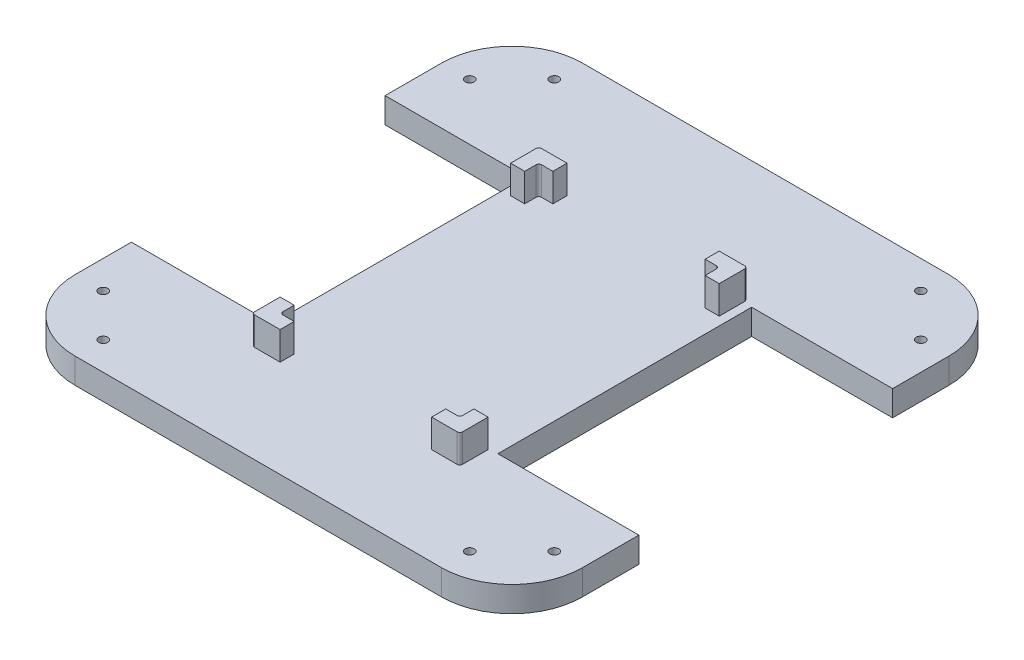
from build123d import *

# Parameters (mm, degrees)
PLATE_DEPTH               = 9
SKETCH3_R                 = 1.6
HEX_HOLES_DEPTH           = 128.597021909
RASPBERRY_PI_HOLDER_DEPTH = 10
FILLET1_R                 = 1
SKETCH5_W                 = 50
SKETCH5_H                 = 90
CUT_EXTRUDE1_DEPTH        = 128.671453348


with BuildPart() as part:
    # Sketch1 → Plate (new body)
    with BuildSketch(Plane(origin=(0, 0, 0), x_dir=(1, 0, 0), z_dir=(0, 1, 0))):
        with BuildLine():
            Line((-65, -90), (65, -90))
            ThreePointArc((65, -90), (82.67766953, -82.67766953), (90, -65))
            Line((90, -65), (90, 65))
            ThreePointArc((90, 65), (82.67766953, 82.67766953), (65, 90))
            Line((65, 90), (-65, 90))
            ThreePointArc((-65, 90), (-82.67766953, 82.67766953), (-90, 65))
            Line((-90, 65), (-90, -65))
            ThreePointArc((-90, -65), (-82.67766953, -82.67766953), (-65, -90))
        make_face()
    extrude(amount=PLATE_DEPTH)

    # Sketch3 → Hex Holes (cut, through all)
    with BuildSketch(Plane(origin=(0, 9, 0), x_dir=(1, 0, 0), z_dir=(0, 1, 0))):
        with Locations((-65, 80)):
            Circle(SKETCH3_R)
        with Locations((-80, 65)):
            Circle(SKETCH3_R)
        with Locations((80, 65)):
            Circle(SKETCH3_R)
        with Locations((80, -65)):
            Circle(SKETCH3_R)
        with Locations((65, 80)):
            Circle(SKETCH3_R)
        with Locations((65, -80)):
            Circle(SKETCH3_R)
        with Locations((-65, -80)):
            Circle(SKETCH3_R)
        with Locations((-80, -65)):
            Circle(SKETCH3_R)
    extrude(amount=-HEX_HOLES_DEPTH, mode=Mode.SUBTRACT)

    # Sketch4 → Raspberry Pi Holder (add)
    with BuildSketch(Plane(origin=(0, 9, 0), x_dir=(1, 0, 0), z_dir=(0, 1, 0))):
        Polygon((-32, 36.5), (-32, 41.5), (-27, 41.5), (-27, 46.5), (-37, 46.5), (-37, 36.5), align=None)
        Polygon((27, 46.5), (37, 46.5), (37, 36.5), (32, 36.5), (32, 41.5), (27, 41.5), align=None)
        Polygon((-36.75, -45.5), (-36.75, -55.5), (-26.75, -55.5), (-26.75, -50.5), (-31.75, -50.5), (-31.75, -45.5), align=None)
        Polygon((27, -50.5), (27, -55.5), (37, -55.5), (37, -45.5), (32, -45.5), (32, -50.5), align=None)
    extrude(amount=RASPBERRY_PI_HOLDER_DEPTH)

    # Fillet1
    fillet1_edges = [part.edges().sort_by_distance(p)[0] for p in [
        (-37, 14, -46.5),
        (-32, 14, -41.5),
        (-31.75, 14, 50.5),
        (-36.75, 14, 55.5),
        (32, 14, 50.5),
        (37, 14, 55.5),
        (37, 14, -46.5),
        (32, 14, -41.5),
    ]]
    fillet(fillet1_edges, radius=FILLET1_R)

    # Sketch5 → Cut-Extrude1 (cut, through all)
    with BuildSketch(Plane(origin=(0, 9, 0), x_dir=(1, 0, 0), z_dir=(0, 1, 0))):
        with Locations((-65, 0)):
            Rectangle(SKETCH5_W, SKETCH5_H)
        with Locations((65, 0)):
            Rectangle(SKETCH5_W, SKETCH5_H)
    extrude(amount=-CUT_EXTRUDE1_DEPTH, mode=Mode.SUBTRACT)


solid = part.part
